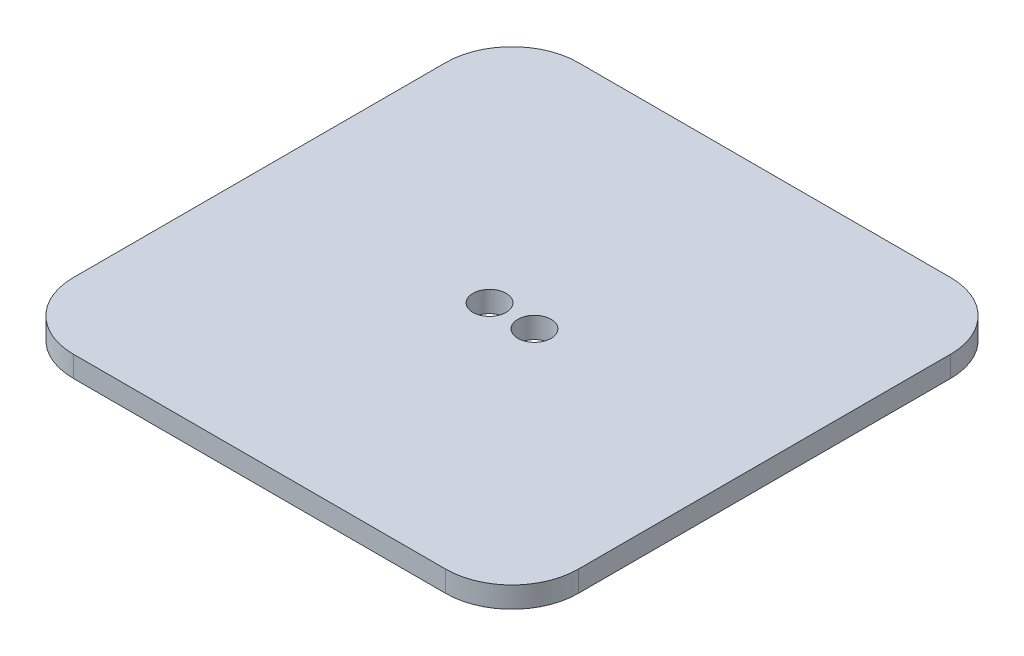
from build123d import *

# Parameters (mm, degrees)
SKETCH1_W           = 76.2
SKETCH1_H           = 76.2
BOSS_EXTRUDE1_DEPTH = 3.175
FILLET1_R           = 10
FILLET2_R           = 10
FILLET3_R           = 10
FILLET4_R           = 10
SKETCH2_R           = 2.5
CUT_EXTRUDE1_DEPTH  = 54.975


with BuildPart() as part:
    # Sketch1 → Boss-Extrude1 (new body)
    with BuildSketch(Plane(origin=(0, 0, 0), x_dir=(1, 0, 0), z_dir=(0, 1, 0))):
        Rectangle(SKETCH1_W, SKETCH1_H)
    extrude(amount=BOSS_EXTRUDE1_DEPTH)

    # Fillet1
    fillet1_edges = [part.edges().sort_by_distance(p)[0] for p in [
        (-38.1, 1.5875, 38.1),
    ]]
    fillet(fillet1_edges, radius=FILLET1_R)

    # Fillet2
    fillet2_edges = [part.edges().sort_by_distance(p)[0] for p in [
        (-38.1, 1.5875, -38.1),
    ]]
    fillet(fillet2_edges, radius=FILLET2_R)

    # Fillet3
    fillet3_edges = [part.edges().sort_by_distance(p)[0] for p in [
        (38.1, 1.5875, -38.1),
    ]]
    fillet(fillet3_edges, radius=FILLET3_R)

    # Fillet4
    fillet4_edges = [part.edges().sort_by_distance(p)[0] for p in [
        (38.1, 1.5875, 38.1),
    ]]
    fillet(fillet4_edges, radius=FILLET4_R)

    # Sketch2 → Cut-Extrude1 (cut, through all)
    with BuildSketch(Plane(origin=(0, 3.175, 0), x_dir=(1, 0, 0), z_dir=(0, 1, 0))):
        with Locations((3.3909, 0)):
            Circle(SKETCH2_R)
        with Locations((-3.3909, 0)):
            Circle(SKETCH2_R)
    extrude(amount=-CUT_EXTRUDE1_DEPTH, mode=Mode.SUBTRACT)


solid = part.part
